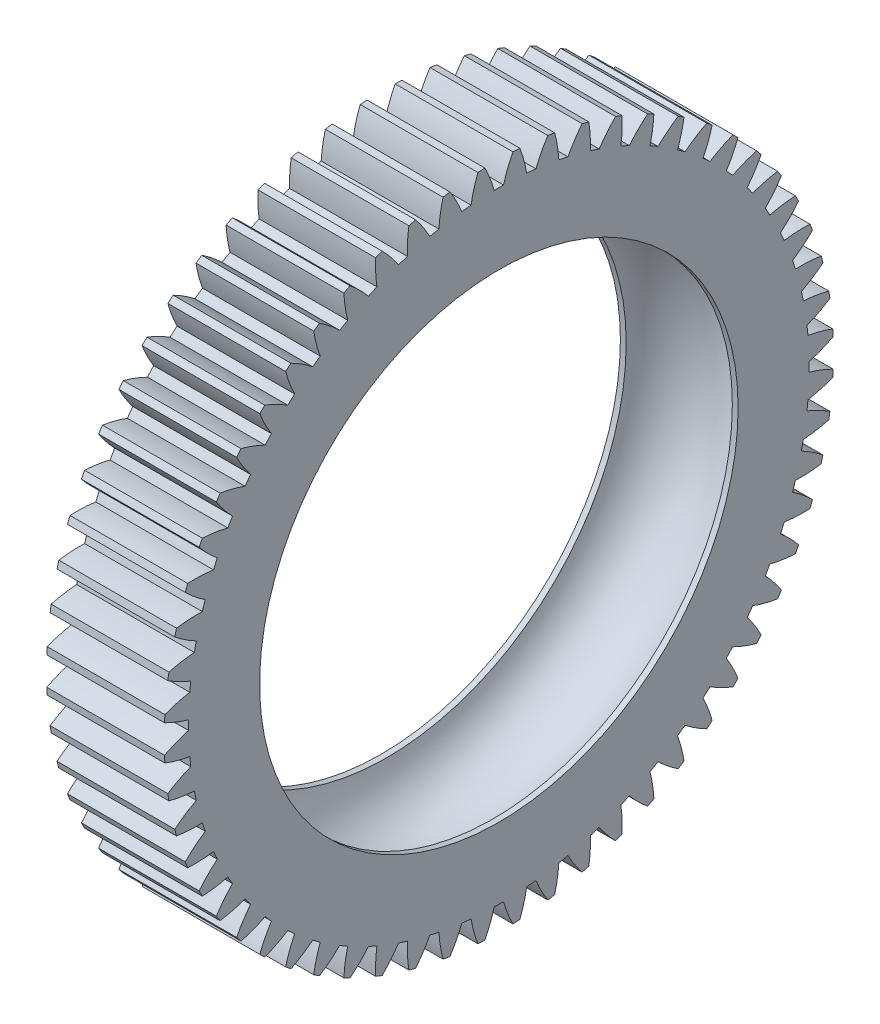
from build123d import *

# Parameters (mm, degrees)
BASPROSKE_W             = 7
BASPROSKE_H             = 15.5
TOOTHCUT_DEPTH          = 24.010866998
TEETHCUTS_COUNT         = 60
TEETHCUTS_ANGLE         = 354
BORSKE_R                = 10
BORE_DEPTH              = 50.0000508
SCALE1_SCALE            = 0.97
CUT_EXTRUDE1_DEPTH      = 3
CUT_EXTRUDE1_DEPTH_BACK = 31
SKETCH1_R               = 10
CUT_SWEEP2_PROFILE_R    = 2.5
SKETCH19_R              = 21.106047463
CUT_EXTRUDE2_DEPTH      = 0.75
SKETCH21_R              = 17.763202132
CUT_EXTRUDE3_DEPTH      = 0.75
SKETCH23_R              = 10.75
CUT_EXTRUDE4_DEPTH      = 10


with BuildPart() as part:
    # BasProSke → Base-Revolve (revolve)
    with BuildSketch(Plane(origin=(0, 0, 0), x_dir=(1, 0, 0), z_dir=(0, 1, 0))):
        with Locations((3.5, 7.75)):
            Rectangle(BASPROSKE_W, BASPROSKE_H)
    revolve(axis=Axis((-10, 0, 0), (1, 0, 0)))

    # TooCutSke → ToothCut (cut, through all)
    with BuildSketch(Plane(origin=(0, 0, 0), x_dir=(0, 0, -1), z_dir=(1, 0, 0))):
        with BuildLine():
            ThreePointArc((0.21493681, 14.372392917), (0, 14.374), (-0.21493681, 14.372392917))
            ThreePointArc((-0.21493681, 14.372392917), (-0.409732631, 14.953266942), (-0.662749221, 15.51124781))
            ThreePointArc((-0.662749221, 15.51124781), (0, 15.5254), (0.662749221, 15.51124781))
            ThreePointArc((0.662749221, 15.51124781), (0.409732631, 14.953266942), (0.21493681, 14.372392917))
        make_face()
    toothcut = extrude(amount=TOOTHCUT_DEPTH, mode=Mode.SUBTRACT)

    # TeethCuts: ToothCut ×60 about axis
    teethcuts_axis = Axis((-10, 0, 0), (1, 0, 0))
    for i in range(1, TEETHCUTS_COUNT):
        add(toothcut.rotate(teethcuts_axis, i * TEETHCUTS_ANGLE / (TEETHCUTS_COUNT - 1)), mode=Mode.SUBTRACT)

    # BorSke → Bore (cut, symmetric)
    with BuildSketch(Plane(origin=(0, 0, 0), x_dir=(0, 0, -1), z_dir=(1, 0, 0))):
        Circle(BORSKE_R)
    extrude(amount=BORE_DEPTH, both=True, mode=Mode.SUBTRACT)


with BuildPart() as part_1:
    # Scale1: scaled about (3.5, 0, 0)
    add(part.part.scale(SCALE1_SCALE).moved(Location((0.105, 0, 0))))

    # Sketch1 → Cut-Extrude1 (cut, two sides: drawn at the far end of the back side and taken through both)
    with BuildSketch(Plane(origin=(6.895, 0, 0), x_dir=(0, 0, -1), z_dir=(1, 0, 0)).offset(-CUT_EXTRUDE1_DEPTH_BACK)):
        Circle(SKETCH1_R)
    extrude(amount=CUT_EXTRUDE1_DEPTH + CUT_EXTRUDE1_DEPTH_BACK, mode=Mode.SUBTRACT)

    # Cut-Sweep2: sweep along a path in Sketch11
    with BuildLine(Plane(origin=(3.5, 0, 0), x_dir=(0, 0, -1), z_dir=(1, 0, 0))) as cut_sweep2_path:
        CenterArc((0, 0), 10, 0, 360)
    # Cut-Sweep2 profile (on start of the path) → Cut-Sweep2 (sweep, cut)
    with BuildSketch(Plane(origin=(3.5, 0, -10), x_dir=(0, 0, 1), z_dir=(0, 1, 0))):
        Circle(CUT_SWEEP2_PROFILE_R)
    sweep(path=cut_sweep2_path.line, mode=Mode.SUBTRACT)

    # Sketch19 → Cut-Extrude2 (cut)
    with BuildSketch(Plane(origin=(6.895, 0, 0), x_dir=(0, 0, -1), z_dir=(1, 0, 0))):
        Circle(SKETCH19_R)
    extrude(amount=-CUT_EXTRUDE2_DEPTH, mode=Mode.SUBTRACT)

    # Sketch21 → Cut-Extrude3 (cut)
    with BuildSketch(Plane.ZY.offset(-0.105)):
        Circle(SKETCH21_R)
    extrude(amount=-CUT_EXTRUDE3_DEPTH, mode=Mode.SUBTRACT)

    # Sketch23 → Cut-Extrude4 (cut)
    with BuildSketch(Plane(origin=(6.145, 0, 0), x_dir=(0, 0, -1), z_dir=(1, 0, 0))):
        Circle(SKETCH23_R)
    extrude(amount=-CUT_EXTRUDE4_DEPTH, mode=Mode.SUBTRACT)


solid = part_1.part
